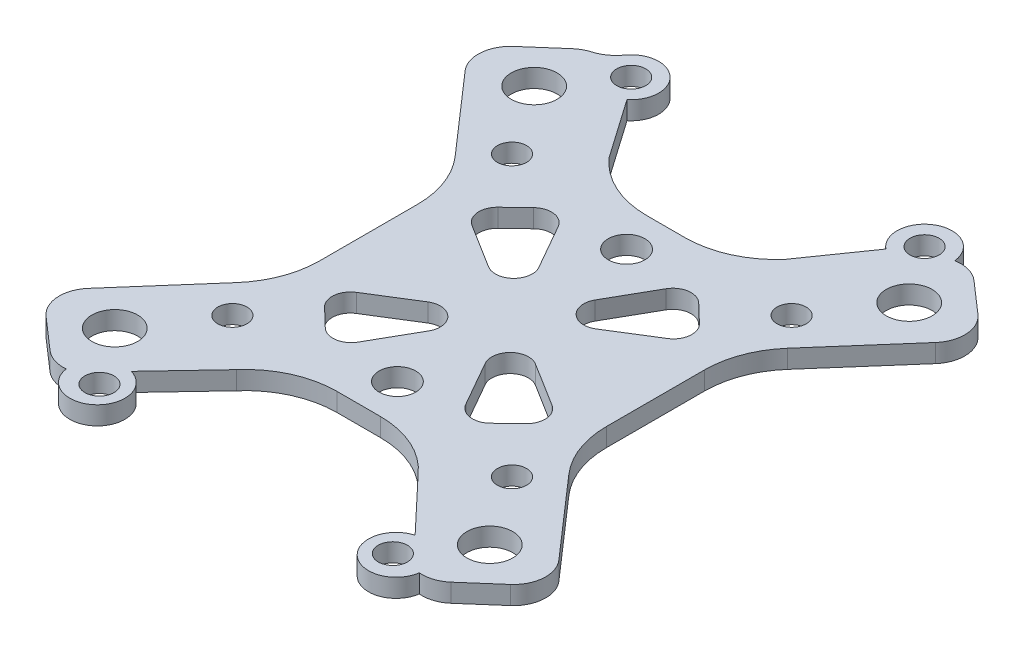
from build123d import *

# Parameters (mm, degrees)
CROQUIS2_R              = 1.5875
CROQUIS2_R_2            = 2.5
CROQUIS2_R_3            = 1.59
CROQUIS2_R_4            = 2
SALIENTE_EXTRUIR1_DEPTH = 2


with BuildPart() as part:
    # Croquis2 → Saliente-Extruir1 (new body)
    with BuildSketch(Plane(origin=(0, 0, 0), x_dir=(1, 0, 0), z_dir=(0, 1, 0))):
        with BuildLine():
            ThreePointArc((-15.6443026, -5.332651407), (-16.282242792, -8.847169319), (-18.114669831, -11.913276785))
            Line((-18.114669831, -11.913276785), (-25.665833323, -20.55341124))
            ThreePointArc((-25.665833323, -20.55341124), (-26.522572581, -23.091497469), (-25.333680736, -25.492001591))
            Line((-25.333680736, -25.492001591), (-21.870049663, -28.519089265))
            ThreePointArc((-21.870049663, -28.519089265), (-20.651030144, -29.211556696), (-19.258050197, -29.370070411))
            ThreePointArc((-19.258050197, -29.370070411), (-14.308280019, -31.191358923), (-15.481364298, -26.049259163))
            Line((-15.481364298, -26.049259163), (-9.898337732, -20.139552173))
            ThreePointArc((-9.898337732, -20.139552173), (-6.503541491, -17.615062127), (-2.368704963, -16.720177551))
            Line((-2.368704963, -16.720177551), (2.368704963, -16.720177551))
            ThreePointArc((2.368704963, -16.720177551), (6.503541491, -17.615062127), (9.898337732, -20.139552173))
            Line((9.898337732, -20.139552173), (15.481364298, -26.049259163))
            ThreePointArc((15.481364298, -26.049259163), (14.308280019, -31.191358923), (19.258050197, -29.370070411))
            ThreePointArc((19.258050197, -29.370070411), (20.651030144, -29.211556696), (21.870049663, -28.519089265))
            Line((21.870049663, -28.519089265), (25.333680736, -25.492001591))
            ThreePointArc((25.333680736, -25.492001591), (26.522572581, -23.091497469), (25.665833323, -20.55341124))
            Line((25.665833323, -20.55341124), (18.114669831, -11.913276785))
            ThreePointArc((18.114669831, -11.913276785), (16.282242792, -8.847169319), (15.6443026, -5.332651407))
            Line((15.6443026, -5.332651407), (15.6443026, 5.332651407))
            ThreePointArc((15.6443026, 5.332651407), (16.282242792, 8.847169319), (18.114669831, 11.913276785))
            Line((18.114669831, 11.913276785), (25.665833323, 20.55341124))
            ThreePointArc((25.665833323, 20.55341124), (26.522572581, 23.091497469), (25.333680736, 25.492001591))
            Line((25.333680736, 25.492001591), (21.870049663, 28.519089265))
            ThreePointArc((21.870049663, 28.519089265), (20.516496212, 29.244060494), (18.982893754, 29.319913825))
            ThreePointArc((18.982893754, 29.319913825), (14.561676067, 31.632721836), (14.119221437, 26.662764026))
            Line((14.119221437, 26.662764026), (9.609072603, 20.201124228))
            ThreePointArc((9.609072603, 20.201124228), (6.214276361, 17.676634182), (2.079439834, 16.781749607))
            Line((2.079439834, 16.781749607), (-2.079439834, 16.781749607))
            ThreePointArc((-2.079439834, 16.781749607), (-6.214276361, 17.676634182), (-9.609072603, 20.201124228))
            Line((-9.609072603, 20.201124228), (-14.119221437, 26.662764026))
            ThreePointArc((-14.119221437, 26.662764026), (-13.940786386, 31.181659757), (-18.441858832, 30.742792428))
            ThreePointArc((-18.441858832, 30.742792428), (-19.378360111, 29.807558957), (-20.568781865, 29.229119385))
            ThreePointArc((-20.568781865, 29.229119385), (-21.257437362, 28.943786272), (-21.870049663, 28.519089265))
            Line((-21.870049663, 28.519089265), (-25.333680736, 25.492001591))
            ThreePointArc((-25.333680736, 25.492001591), (-26.522572581, 23.091497469), (-25.665833323, 20.55341124))
            Line((-25.665833323, 20.55341124), (-18.114669831, 11.913276785))
            ThreePointArc((-18.114669831, 11.913276785), (-16.282242792, 8.847169319), (-15.6443026, 5.332651407))
            Line((-15.6443026, 5.332651407), (-15.6443026, -5.332651407))
        make_face()
        with Locations((-16, -29)):
            Circle(CROQUIS2_R, mode=Mode.SUBTRACT)
        with Locations((-20.453154045, -22.873296448)):
            Circle(CROQUIS2_R_2, mode=Mode.SUBTRACT)
        with Locations((-15.25, -15.25)):
            Circle(CROQUIS2_R_3, mode=Mode.SUBTRACT)
        with BuildLine():
            Line((-3.074423593, -5.999581964), (-5.873559772, -10.915994174))
            ThreePointArc((-5.873559772, -10.915994174), (-7.324662306, -11.905756202), (-8.997091839, -11.368814033))
            Line((-8.997091839, -11.368814033), (-10.997834751, -9.446969084))
            ThreePointArc((-10.997834751, -9.446969084), (-11.601593103, -7.79748332), (-10.670982222, -6.30775488))
            Line((-10.670982222, -6.30775488), (-5.87110313, -3.313187619))
            ThreePointArc((-5.87110313, -3.313187619), (-3.426979279, -3.567667883), (-3.074423593, -5.999581964))
        make_face(mode=Mode.SUBTRACT)
        with Locations((16, -29)):
            Circle(CROQUIS2_R, mode=Mode.SUBTRACT)
        with Locations((20.453154045, -22.873296448)):
            Circle(CROQUIS2_R_2, mode=Mode.SUBTRACT)
        with Locations((0, -12.497128708)):
            Circle(CROQUIS2_R_4, mode=Mode.SUBTRACT)
        with BuildLine():
            Line((10.997834751, -9.446969084), (8.997091839, -11.368814033))
            ThreePointArc((8.997091839, -11.368814033), (7.324662306, -11.905756202), (5.873559772, -10.915994174))
            Line((5.873559772, -10.915994174), (3.074423593, -5.999581964))
            ThreePointArc((3.074423593, -5.999581964), (3.426979279, -3.567667883), (5.87110313, -3.313187619))
            Line((5.87110313, -3.313187619), (10.670982222, -6.30775488))
            ThreePointArc((10.670982222, -6.30775488), (11.601593103, -7.79748332), (10.997834751, -9.446969084))
        make_face(mode=Mode.SUBTRACT)
        with Locations((15.25, -15.25)):
            Circle(CROQUIS2_R_3, mode=Mode.SUBTRACT)
        with Locations((-15.25, 15.25)):
            Circle(CROQUIS2_R_3, mode=Mode.SUBTRACT)
        with BuildLine():
            Line((-10.997834751, 9.446969084), (-8.997091839, 11.368814033))
            ThreePointArc((-8.997091839, 11.368814033), (-7.324662306, 11.905756202), (-5.873559772, 10.915994174))
            Line((-5.873559772, 10.915994174), (-3.074423593, 5.999581964))
            ThreePointArc((-3.074423593, 5.999581964), (-3.426979279, 3.567667883), (-5.87110313, 3.313187619))
            Line((-5.87110313, 3.313187619), (-10.670982222, 6.30775488))
            ThreePointArc((-10.670982222, 6.30775488), (-11.601593103, 7.79748332), (-10.997834751, 9.446969084))
        make_face(mode=Mode.SUBTRACT)
        with Locations((-20.453154045, 22.873296448)):
            Circle(CROQUIS2_R_2, mode=Mode.SUBTRACT)
        with Locations((-16, 29)):
            Circle(CROQUIS2_R, mode=Mode.SUBTRACT)
        with BuildLine():
            Line((3.074423593, 5.999581964), (5.873559772, 10.915994174))
            ThreePointArc((5.873559772, 10.915994174), (7.324662306, 11.905756202), (8.997091839, 11.368814033))
            Line((8.997091839, 11.368814033), (10.997834751, 9.446969084))
            ThreePointArc((10.997834751, 9.446969084), (11.601593103, 7.79748332), (10.670982222, 6.30775488))
            Line((10.670982222, 6.30775488), (5.87110313, 3.313187619))
            ThreePointArc((5.87110313, 3.313187619), (3.426979279, 3.567667883), (3.074423593, 5.999581964))
        make_face(mode=Mode.SUBTRACT)
        with Locations((0, 12.497128708)):
            Circle(CROQUIS2_R_4, mode=Mode.SUBTRACT)
        with Locations((15.25, 15.25)):
            Circle(CROQUIS2_R_3, mode=Mode.SUBTRACT)
        with Locations((20.453154045, 22.873296448)):
            Circle(CROQUIS2_R_2, mode=Mode.SUBTRACT)
        with Locations((16, 29)):
            Circle(CROQUIS2_R, mode=Mode.SUBTRACT)
    extrude(amount=SALIENTE_EXTRUIR1_DEPTH)


solid = part.part
